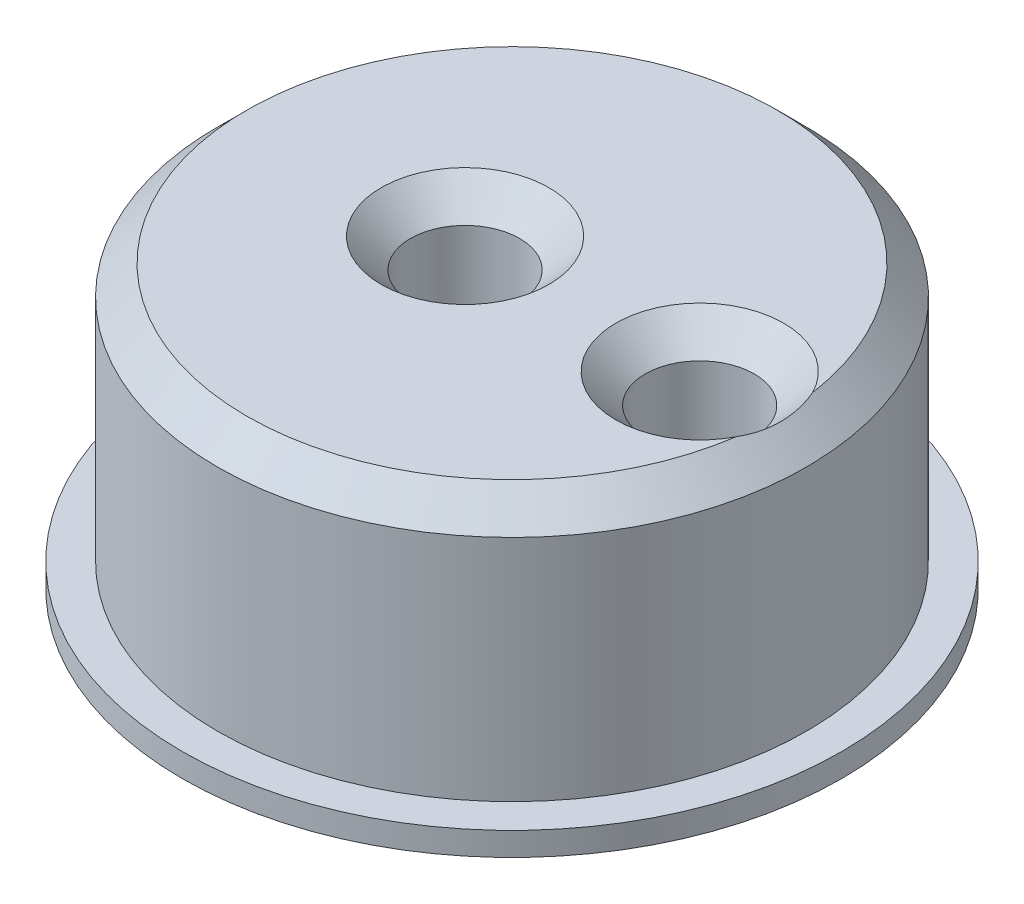
from build123d import *
from build123d.topology import SkipClean

# Parameters (mm, degrees)
SKETCH_1_R      = 5.02
SKETCH_1_R_2    = 0.93
EXTRUDE_1_DEPTH = 4.4
EXTRUDE_START   = 0.4
SKETCH_3_R      = 5.62
SKETCH_3_R_2    = 0.93
EXTRUDE_2_DEPTH = 0.4
CHAMFER_1_SIZE  = 0.5


with BuildPart() as part:
    # 草图1 → 凸台-拉伸1 (new body)
    with BuildSketch(Plane(origin=(0, 0, 0), x_dir=(1, 0, 0), z_dir=(0, 1, 0))):
        with Locations(Location((0, 0, 0), (0, 0, 270))):
            Circle(SKETCH_1_R)
        with Locations(Location((3.2, 0, 0), (0, 0, 270))):
            Circle(SKETCH_1_R_2, mode=Mode.SUBTRACT)
        with Locations(Location((-0.8, 0, 0), (0, 0, 90))):
            Circle(SKETCH_1_R_2, mode=Mode.SUBTRACT)
    extrude(amount=EXTRUDE_1_DEPTH)

    # 草图3 → 凸台-拉伸2 (add)
    with SkipClean():  # the faces are left unmerged after this step: merging them gives an invalid solid
        with BuildSketch(Plane.XZ.offset(EXTRUDE_START)):
            with Locations(Location((0, 0, 0), (0, 0, 270))):
                Circle(SKETCH_3_R)
            with Locations(Location((3.2, 0, 0), (0, 0, 270))):
                Circle(SKETCH_3_R_2, mode=Mode.SUBTRACT)
            with Locations(Location((-0.8, 0, 0), (0, 0, 270))):
                Circle(SKETCH_3_R_2, mode=Mode.SUBTRACT)
        extrude(amount=-EXTRUDE_2_DEPTH)

    # 倒角1
    # the kernel refuses this chamfer: 0.5 mm, written as the material it takes off along each edge
    with BuildSketch(Plane(origin=(3.2, -0.4, 0), x_dir=(0, 0, -1), z_dir=(-1, 0, 0))) as chamfer_1_piece_1:
        Polygon((0.93 + CHAMFER_1_SIZE, 0), (0.93, -CHAMFER_1_SIZE), (0.93, 0), align=None)
    revolve(axis=Axis((3.2, -0.4, 0), (0, -1, 0)), mode=Mode.SUBTRACT)
    with BuildSketch(Plane(origin=(-0.8, -0.4, 0), x_dir=(0, 0, -1), z_dir=(-1, 0, 0))) as chamfer_1_piece_2:
        Polygon((0.93 + CHAMFER_1_SIZE, 0), (0.93, -CHAMFER_1_SIZE), (0.93, 0), align=None)
    revolve(axis=Axis((-0.8, -0.4, 0), (0, -1, 0)), mode=Mode.SUBTRACT)
    with BuildSketch(Plane(origin=(0, 4.4, 0), x_dir=(0, 0, 1), z_dir=(-1, 0, 0))) as chamfer_1_piece_3:
        Polygon((5.02, -CHAMFER_1_SIZE), (5.02 - CHAMFER_1_SIZE, 0), (5.02, 0), align=None)
    revolve(axis=Axis((0, 4.4, 0), (0, 1, 0)), mode=Mode.SUBTRACT)
    with BuildSketch(Plane(origin=(3.2, 4.4, 0), x_dir=(0, 0, 1), z_dir=(-1, 0, 0))) as chamfer_1_piece_4:
        Polygon((0.93 + CHAMFER_1_SIZE, 0), (0.93, -CHAMFER_1_SIZE), (0.93, 0), align=None)
    revolve(axis=Axis((3.2, 4.4, 0), (0, 1, 0)), mode=Mode.SUBTRACT)
    with BuildSketch(Plane(origin=(-0.8, 4.4, 0), x_dir=(0, 0, -1), z_dir=(1, 0, 0))) as chamfer_1_piece_5:
        Polygon((0.93 + CHAMFER_1_SIZE, 0), (0.93, -CHAMFER_1_SIZE), (0.93, 0), align=None)
    revolve(axis=Axis((-0.8, 4.4, 0), (0, 1, 0)), mode=Mode.SUBTRACT)


solid = part.part
